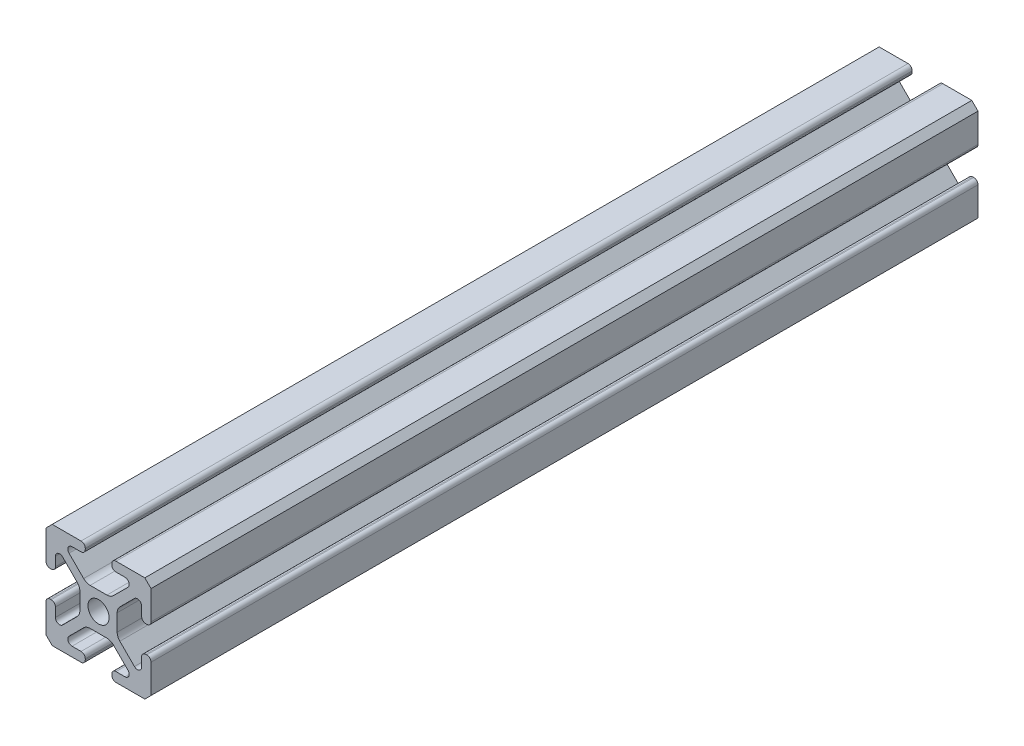
from build123d import *

# Parameters (mm, degrees)
BOSS_EXTRUDE1_DEPTH = 200


with BuildPart() as part:
    # Sketch1 → Boss-Extrude1 (new body)
    with BuildSketch(Plane.XY):
        with BuildLine():
            Line((-11.199951579, -12.7), (-4.222256762, -12.7))
            ThreePointArc((-4.222256762, -12.7), (-3.503836272, -12.40242049), (-3.206256762, -11.684))
            Line((-3.206256762, -11.684), (-3.206256762, -11.440665395))
            ThreePointArc((-3.206256762, -11.440665395), (-3.503836272, -10.722244905), (-4.222256762, -10.424665395))
            Line((-4.222256762, -10.424665395), (-6.40926672, -10.424665395))
            ThreePointArc((-6.40926672, -10.424665395), (-7.347928334, -9.797471742), (-7.127687178, -8.690244874))
            Line((-7.127687178, -8.690244874), (-3.593166694, -5.155724698))
            ThreePointArc((-3.593166694, -5.155724698), (-2.876257435, -4.67670128), (-2.030605322, -4.508490626))
            Line((-2.030605322, -4.508490626), (2.030598864, -4.508490626))
            ThreePointArc((2.030598864, -4.508490626), (2.876251031, -4.676701303), (3.593160319, -5.155724782))
            Line((3.593160319, -5.155724782), (7.127680379, -8.690244912))
            ThreePointArc((7.127680379, -8.690244912), (7.347921489, -9.019859032), (7.425259882, -9.408665395))
            ThreePointArc((7.425259882, -9.408665395), (7.127680372, -10.127085884), (6.409259882, -10.424665395))
            Line((6.409259882, -10.424665395), (4.22225065, -10.424665395))
            ThreePointArc((4.22225065, -10.424665395), (3.50383016, -10.722244905), (3.20625065, -11.440665395))
            Line((3.20625065, -11.440665395), (3.20625065, -11.684))
            ThreePointArc((3.20625065, -11.684), (3.50383016, -12.40242049), (4.22225065, -12.7))
            Line((4.22225065, -12.7), (11.199952422, -12.7))
            Line((11.199952422, -12.7), (12.7, -11.199951732))
            Line((12.7, -11.199951732), (12.7, -4.222256762))
            ThreePointArc((12.7, -4.222256762), (12.40242049, -3.503836272), (11.684, -3.206256762))
            Line((11.684, -3.206256762), (11.440665395, -3.206256762))
            ThreePointArc((11.440665395, -3.206256762), (10.722244905, -3.503836272), (10.424665395, -4.222256762))
            Line((10.424665395, -4.222256762), (10.424665395, -6.40926672))
            ThreePointArc((10.424665395, -6.40926672), (9.797471742, -7.347928334), (8.690244874, -7.127687178))
            Line((8.690244874, -7.127687178), (5.155724698, -3.593166694))
            ThreePointArc((5.155724698, -3.593166694), (4.67670128, -2.876257435), (4.508490626, -2.030605322))
            Line((4.508490626, -2.030605322), (4.508490626, 2.030598864))
            ThreePointArc((4.508490626, 2.030598864), (4.676701303, 2.876251031), (5.155724782, 3.593160319))
            Line((5.155724782, 3.593160319), (8.690244912, 7.127680379))
            ThreePointArc((8.690244912, 7.127680379), (9.019859032, 7.347921489), (9.408665395, 7.425259882))
            ThreePointArc((9.408665395, 7.425259882), (10.127085884, 7.127680372), (10.424665395, 6.409259882))
            Line((10.424665395, 6.409259882), (10.424665395, 4.22225065))
            ThreePointArc((10.424665395, 4.22225065), (10.722244905, 3.50383016), (11.440665395, 3.20625065))
            Line((11.440665395, 3.20625065), (11.684, 3.20625065))
            ThreePointArc((11.684, 3.20625065), (12.40242049, 3.50383016), (12.7, 4.22225065))
            Line((12.7, 4.22225065), (12.7, 11.199954756))
            Line((12.7, 11.199954756), (11.199954423, 12.7))
            Line((11.199954423, 12.7), (4.222256762, 12.7))
            ThreePointArc((4.222256762, 12.7), (3.503836272, 12.40242049), (3.206256762, 11.684))
            Line((3.206256762, 11.684), (3.206256762, 11.440665395))
            ThreePointArc((3.206256762, 11.440665395), (3.503836272, 10.722244905), (4.222256762, 10.424665395))
            Line((4.222256762, 10.424665395), (6.40926672, 10.424665395))
            ThreePointArc((6.40926672, 10.424665395), (7.347928334, 9.797471742), (7.127687178, 8.690244874))
            Line((7.127687178, 8.690244874), (3.593166694, 5.155724698))
            ThreePointArc((3.593166694, 5.155724698), (2.876257435, 4.67670128), (2.030605322, 4.508490626))
            Line((2.030605322, 4.508490626), (-2.030598864, 4.508490626))
            ThreePointArc((-2.030598864, 4.508490626), (-2.876251031, 4.676701303), (-3.593160319, 5.155724782))
            Line((-3.593160319, 5.155724782), (-7.127680379, 8.690244912))
            ThreePointArc((-7.127680379, 8.690244912), (-7.347921489, 9.019859032), (-7.425259882, 9.408665395))
            ThreePointArc((-7.425259882, 9.408665395), (-7.127680372, 10.127085884), (-6.409259882, 10.424665395))
            Line((-6.409259882, 10.424665395), (-4.22225065, 10.424665395))
            ThreePointArc((-4.22225065, 10.424665395), (-3.50383016, 10.722244905), (-3.20625065, 11.440665395))
            Line((-3.20625065, 11.440665395), (-3.20625065, 11.684))
            ThreePointArc((-3.20625065, 11.684), (-3.50383016, 12.40242049), (-4.22225065, 12.7))
            Line((-4.22225065, 12.7), (-11.199951733, 12.7))
            Line((-11.199951733, 12.7), (-12.7, 11.1999514))
            Line((-12.7, 11.1999514), (-12.7, 4.222256762))
            ThreePointArc((-12.7, 4.222256762), (-12.40242049, 3.503836272), (-11.684, 3.206256762))
            Line((-11.684, 3.206256762), (-11.440665395, 3.206256762))
            ThreePointArc((-11.440665395, 3.206256762), (-10.722244905, 3.503836272), (-10.424665395, 4.222256762))
            Line((-10.424665395, 4.222256762), (-10.424665395, 6.40926672))
            ThreePointArc((-10.424665395, 6.40926672), (-9.797471742, 7.347928334), (-8.690244874, 7.127687178))
            Line((-8.690244874, 7.127687178), (-5.155724698, 3.593166694))
            ThreePointArc((-5.155724698, 3.593166694), (-4.67670128, 2.876257435), (-4.508490626, 2.030605322))
            Line((-4.508490626, 2.030605322), (-4.508490626, -2.030598864))
            ThreePointArc((-4.508490626, -2.030598864), (-4.676701303, -2.876251031), (-5.155724782, -3.593160319))
            Line((-5.155724782, -3.593160319), (-8.690244912, -7.127680379))
            ThreePointArc((-8.690244912, -7.127680379), (-9.019859032, -7.347921489), (-9.408665395, -7.425259882))
            ThreePointArc((-9.408665395, -7.425259882), (-10.127085884, -7.127680372), (-10.424665395, -6.409259882))
            Line((-10.424665395, -6.409259882), (-10.424665395, -4.22225065))
            ThreePointArc((-10.424665395, -4.22225065), (-10.722244905, -3.50383016), (-11.440665395, -3.20625065))
            Line((-11.440665395, -3.20625065), (-11.684, -3.20625065))
            ThreePointArc((-11.684, -3.20625065), (-12.40242049, -3.50383016), (-12.7, -4.22225065))
            Line((-12.7, -4.22225065), (-12.7, -11.199952268))
            Line((-12.7, -11.199952268), (-11.199951579, -12.7))
        make_face()
        with BuildLine():
            ThreePointArc((-2.55499489, 0), (0, -2.55499489), (2.55499489, 0))
            ThreePointArc((2.55499489, 0), (0, 2.55499489), (-2.55499489, 0))
        make_face(mode=Mode.SUBTRACT)
    extrude(amount=BOSS_EXTRUDE1_DEPTH)


solid = part.part
